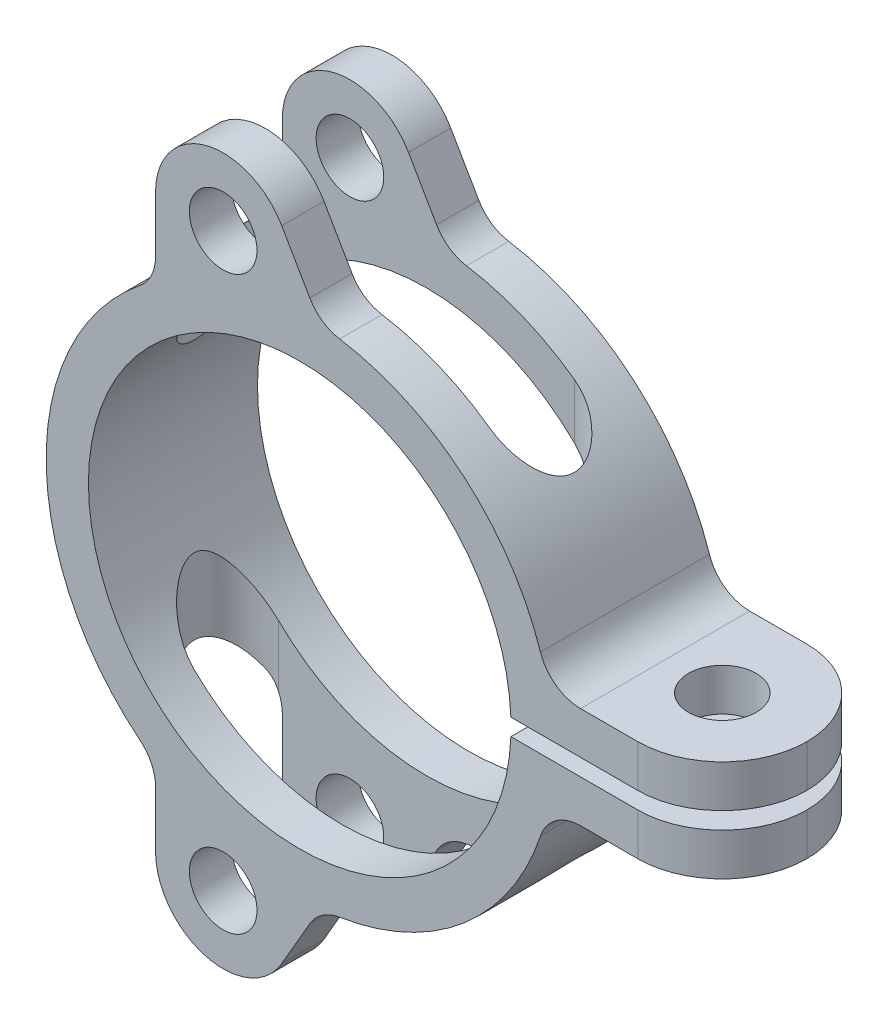
from build123d import *

# Parameters (mm, degrees)
SKETCH1_R              = 4
BOSS_EXTRUDE1_DEPTH    = 20
FILLET1_R              = 10
CUT_EXTRUDE1_START     = -41.80740392
CUT_EXTRUDE1_OUTLINE_R = 4
CUT_EXTRUDE1_DEPTH     = 83.61480784
FILLET2_R              = 5


# Read off the part's stored shape, not the designer's step: Cut-Extrude1
with BuildPart() as part:
    # Sketch1 → Boss-Extrude1 (new body)
    with BuildSketch(Plane(origin=(0, 0, 0), x_dir=(0, 1, 0), z_dir=(0, 0, 1))):
        with BuildLine():
            ThreePointArc((24.677963744, 17.058666579), (0, 30), (-24.677963744, 17.058666579))
            Line((-24.677963744, 17.058666579), (-33.80740392, 17.058666579))
            ThreePointArc((-33.80740392, 17.058666579), (-41.534810495, 11.129219073), (-37.80740416, 2.130463487))
            Line((-37.80740416, 2.130463487), (-29.901076805, -2.43425674))
            ThreePointArc((-29.901076805, -2.43425674), (-22.448320849, -19.901580115), (-6, -29.393876913))
            Line((-6, -29.393876913), (-6, -50))
            Line((-6, -50), (-1, -50))
            Line((-1, -50), (-1, -24.979991994))
            ThreePointArc((-1, -24.979991994), (0, 25), (1, -24.979991994))
            Line((1, -24.979991994), (1, -50))
            Line((1, -50), (6, -50))
            Line((6, -50), (6, -29.393876913))
            ThreePointArc((6, -29.393876913), (22.448320849, -19.901580115), (29.901076805, -2.43425674))
            Line((29.901076805, -2.43425674), (37.807403702, 2.130463222))
            ThreePointArc((37.807403702, 2.130463222), (41.534810563, 11.129218818), (33.80740392, 17.058666579))
            Line((33.80740392, 17.058666579), (24.677963744, 17.058666579))
        make_face()
        with Locations(Location((-33.80740392, 9.058666579, 0), (0, 0, 270))):
            Circle(SKETCH1_R, mode=Mode.SUBTRACT)
        with Locations(Location((33.80740392, 9.058666579, 0), (0, 0, 270))):
            Circle(SKETCH1_R, mode=Mode.SUBTRACT)
    extrude(amount=BOSS_EXTRUDE1_DEPTH)

    # Fillet1
    fillet1_edges = [part.edges().sort_by_distance(p)[0] for p in [
        (50, 3.5, 0),
        (50, 3.5, 20),
        (50, -3.5, 0),
        (50, -3.5, 20),
    ]]
    fillet(fillet1_edges, radius=FILLET1_R - 0.0001)  # a hair under: the kernel refuses the full size

    # Cut-Extrude1 outline → Cut-Extrude1 (cut)
    with BuildSketch(Plane(origin=(0, 0, 0), x_dir=(-1, 0, 0), z_dir=(0, 1, 0)).offset(CUT_EXTRUDE1_START)):
        with BuildLine():
            ThreePointArc((17.5, 5), (22.5, 10), (17.5, 15))
            Line((17.5, 15), (-17.5, 15))
            ThreePointArc((-17.5, 15), (-22.5, 10), (-17.5, 5))
            Line((-17.5, 5), (17.5, 5))
        make_face()
        with Locations((-40, 10)):
            Circle(CUT_EXTRUDE1_OUTLINE_R)
    extrude(amount=CUT_EXTRUDE1_DEPTH, mode=Mode.SUBTRACT)

    # Fillet2
    fillet2_edges = [part.edges().sort_by_distance(p)[0] for p in [
        (29.393876913, -6, 10),
        (2.43425674, -29.901076805, 17.5),
        (2.43425674, -29.901076805, 2.5),
        (-17.058666579, -24.677963744, 17.5),
        (-17.058666579, -24.677963744, 2.5),
        (-17.058666579, 24.677963744, 17.5),
        (-17.058666579, 24.677963744, 2.5),
        (2.43425674, 29.901076805, 2.5),
        (2.43425674, 29.901076805, 17.5),
        (29.393876913, 6, 10),
    ]]
    fillet(fillet2_edges, radius=FILLET2_R)


solid = part.part
